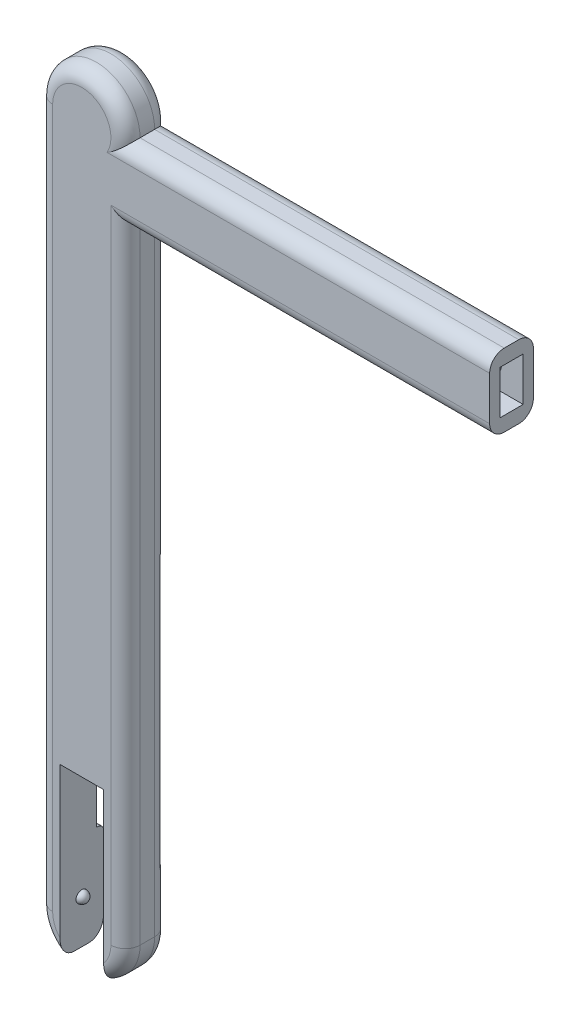
from build123d import *

# Parameters (mm, degrees)
BOSS_EXTRUDE1_DEPTH = 15
FILLET1_R           = 5
SKETCH2_W           = 8
SKETCH2_H           = 15
CUT_EXTRUDE1_DEPTH  = 100
SKETCH3_W           = 15
SKETCH3_H           = 60
CUT_EXTRUDE3_DEPTH  = 100
CUT_EXTRUDE4_DEPTH  = 3.75
SKETCH9_R           = 2.5
CUT_EXTRUDE5_DEPTH  = 7.5
SKETCH10_W          = 2.5
SKETCH10_H          = 90
CUT_EXTRUDE6_DEPTH  = 218.431134352
FILLET2_R           = 2
BOSS_EXTRUDE2_DEPTH = 19
SKETCH12_W          = 13.011456799
SKETCH12_H          = 10.932703346
CUT_EXTRUDE7_DEPTH  = 7


with BuildPart() as part:
    # Sketch1 → Boss-Extrude1 (new body)
    with BuildSketch(Plane.XY):
        with BuildLine():
            Line((-15, -103.255813953), (-15, 136.744186047))
            ThreePointArc((-15, 136.744186047), (0, 151.744186047), (15, 136.744186047))
            Line((15, 136.744186047), (140, 136.744186047))
            Line((140, 136.744186047), (140, 111.744186047))
            Line((140, 111.744186047), (15, 111.744186047))
            Line((15, 111.744186047), (15, -103.255813953))
            ThreePointArc((15, -103.255813953), (0, -118.255813953), (-15, -103.255813953))
        make_face()
    extrude(amount=BOSS_EXTRUDE1_DEPTH)

    # Fillet1
    fillet1_edges = [part.edges().sort_by_distance(p)[0] for p in [
        (0, 151.744186047, 0),
        (-15, 16.744186047, 0),
        (0, -118.255813953, 0),
        (0, 151.744186047, 15),
        (15, 4.244186047, 15),
        (0, -118.255813953, 15),
        (15, 4.244186047, 0),
        (77.5, 136.744186047, 15),
        (77.5, 136.744186047, 0),
        (77.5, 111.744186047, 0),
        (77.5, 111.744186047, 15),
        (-15, 16.744186047, 15),
    ]]
    fillet(fillet1_edges, radius=FILLET1_R)

    # Sketch2 → Cut-Extrude1 (cut)
    with BuildSketch(Plane(origin=(140, 0, 0), x_dir=(0, 0, -1), z_dir=(1, 0, 0))):
        with Locations((-7.5, 124.244186047)):
            Rectangle(SKETCH2_W, SKETCH2_H)
    extrude(amount=-CUT_EXTRUDE1_DEPTH, mode=Mode.SUBTRACT)

    # Sketch3 → Cut-Extrude3 (cut)
    with BuildSketch(Plane.XY.offset(15)):
        with Locations((0, -88.255813953)):
            Rectangle(SKETCH3_W, SKETCH3_H)
    extrude(amount=-CUT_EXTRUDE3_DEPTH, mode=Mode.SUBTRACT)

    # Sketch6 → Revolve1 (revolve)
    with BuildSketch(Plane.XY.offset(7.5)):
        with BuildLine():
            Line((-7.5, -101.255813953), (-5.5, -101.255813953))
            ThreePointArc((-5.5, -101.255813953), (-6.085786438, -99.841600391), (-7.5, -99.255813953))
            Line((-7.5, -99.255813953), (-7.5, -101.255813953))
        make_face()
        with BuildLine():
            Line((7.5, -101.255813953), (5.5, -101.255813953))
            ThreePointArc((5.5, -101.255813953), (6.085786438, -99.841600391), (7.5, -99.255813953))
            Line((7.5, -99.255813953), (7.5, -101.255813953))
        make_face()
    revolve(axis=Axis((22.79505848, -101.255813953, 7.5), (-1, 0, 0)))

    # Sketch8 → Cut-Extrude4 (cut, symmetric)
    with BuildSketch(Plane(origin=(0, 0, 0), x_dir=(0, 0, -1), z_dir=(1, 0, 0))):
        Polygon((-7.5, 91.744186047), (0, 86.49262951), (0, 76.49262951), (-7.5, 81.744186047), align=None)
        Polygon((0, 56.49262951), (0, 66.49262951), (-7.5, 71.744186047), (-7.5, 61.744186047), align=None)
        Polygon((0, 36.49262951), (0, 46.49262951), (-7.5, 51.744186047), (-7.5, 41.744186047), align=None)
    extrude(amount=CUT_EXTRUDE4_DEPTH, both=True, mode=Mode.SUBTRACT)

    # Sketch9 → Cut-Extrude5 (cut)
    with BuildSketch(Plane(origin=(0, 0, 0), x_dir=(-1, 0, 0), z_dir=(0, 0, -1))):
        with Locations((-130, 124.244186047)):
            Circle(SKETCH9_R)
        with Locations((-110, 124.244186047)):
            Circle(SKETCH9_R)
        with Locations((-90, 124.244186047)):
            Circle(SKETCH9_R)
        with Locations((-70, 124.244186047)):
            Circle(SKETCH9_R)
        with Locations((-50, 124.244186047)):
            Circle(SKETCH9_R)
    extrude(amount=-CUT_EXTRUDE5_DEPTH, mode=Mode.SUBTRACT)

    # Sketch10 → Cut-Extrude6 (cut, through all)
    with BuildSketch(Plane.ZY.offset(15)):
        with Locations((1.25, -38.255813953)):
            Rectangle(SKETCH10_W, SKETCH10_H)
    extrude(amount=-CUT_EXTRUDE6_DEPTH, mode=Mode.SUBTRACT)

    # Fillet2
    fillet2_edges = [part.edges().sort_by_distance(p)[0] for p in [
        (12.5, 6.744186047, 0.669872981),
        (-12.5, 6.744186047, 0.669872981),
        (-12.5, -83.255813953, 0.669872981),
        (12.5, -83.255813953, 0.669872981),
        (0, 6.744186047, 0),
        (-8.75, -83.255813953, 0),
        (8.75, -83.255813953, 0),
    ]]
    fillet(fillet2_edges, radius=FILLET2_R)

    # Sketch11 → Boss-Extrude2 (add)
    with BuildSketch(Plane.ZY.offset(15)):
        with BuildLine():
            Line((0, 109.244186047), (0, 101.244186047))
            ThreePointArc((0, 101.244186047), (-0.878679656, 103.36550639), (-3, 104.244186047))
            Line((-3, 104.244186047), (-7, 104.244186047))
            Line((-7, 104.244186047), (-7, 109.244186047))
            Line((-7, 109.244186047), (0, 109.244186047))
        make_face()
    extrude(amount=-BOSS_EXTRUDE2_DEPTH)

    # Sketch12 → Cut-Extrude7 (cut)
    with BuildSketch(Plane(origin=(0, 0, -7), x_dir=(-1, 0, 0), z_dir=(0, 0, -1))):
        with Locations((10.2557284, 106.179286635)):
            Rectangle(SKETCH12_W, SKETCH12_H)
    extrude(amount=-CUT_EXTRUDE7_DEPTH, mode=Mode.SUBTRACT)


solid = part.part
